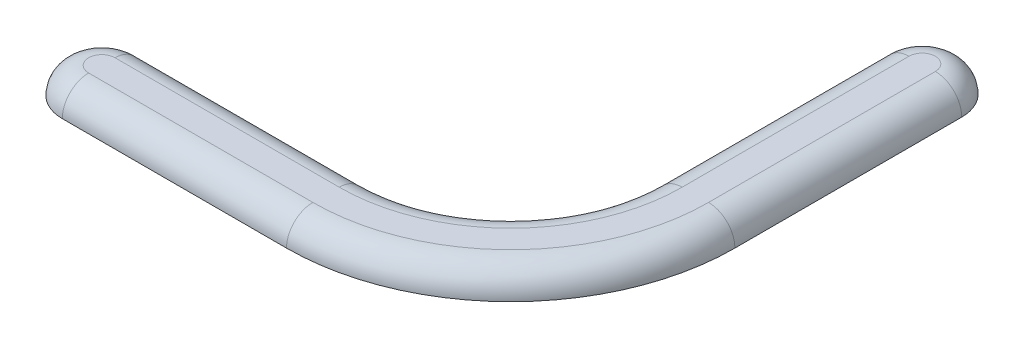
from build123d import *

# Parameters (mm, degrees)
SALIENTE_EXTRUIR1_DEPTH = 0.6
REDONDEO1_R             = 0.6


with BuildPart() as part:
    # Croquis1 → Saliente-Extruir1 (new body)
    with BuildSketch(Plane(origin=(0, 0.456148123, 0), x_dir=(1, 0, 0), z_dir=(0, 1, 0))):
        with BuildLine():
            Line((31.906397954, -103.996253755), (37.006397954, -103.996253755))
            ThreePointArc((37.006397954, -103.996253755), (40.612642538, -102.502498339), (42.106397954, -98.896253755))
            Line((42.106397954, -98.896253755), (42.106397954, -93.736756225))
            ThreePointArc((42.106397954, -93.736756225), (41.206397954, -92.836756225), (40.306397954, -93.736756225))
            Line((40.306397954, -93.736756225), (40.306397954, -98.896253755))
            ThreePointArc((40.306397954, -98.896253755), (39.339850332, -101.229706133), (37.006397954, -102.196253755))
            Line((37.006397954, -102.196253755), (31.906397954, -102.196253755))
            ThreePointArc((31.906397954, -102.196253755), (31.006397954, -103.096253755), (31.906397954, -103.996253755))
        make_face()
    extrude(amount=SALIENTE_EXTRUIR1_DEPTH)

    # Redondeo1
    redondeo1_edges = [part.edges().sort_by_distance(p)[0] for p in [
        (40.306397954, 1.056148123, 96.31650499),
        (39.339850332, 1.056148123, 101.229706133),
        (42.106397954, 1.056148123, 96.31650499),
        (40.612642538, 1.056148123, 102.502498339),
        (41.206397954, 1.056148123, 92.836756225),
        (34.456397954, 1.056148123, 102.196253755),
        (31.006397954, 1.056148123, 103.096253755),
        (34.456397954, 1.056148123, 103.996253755),
    ]]
    fillet(redondeo1_edges, radius=REDONDEO1_R - 0.0001)  # a hair under: the kernel refuses the full size


solid = part.part
